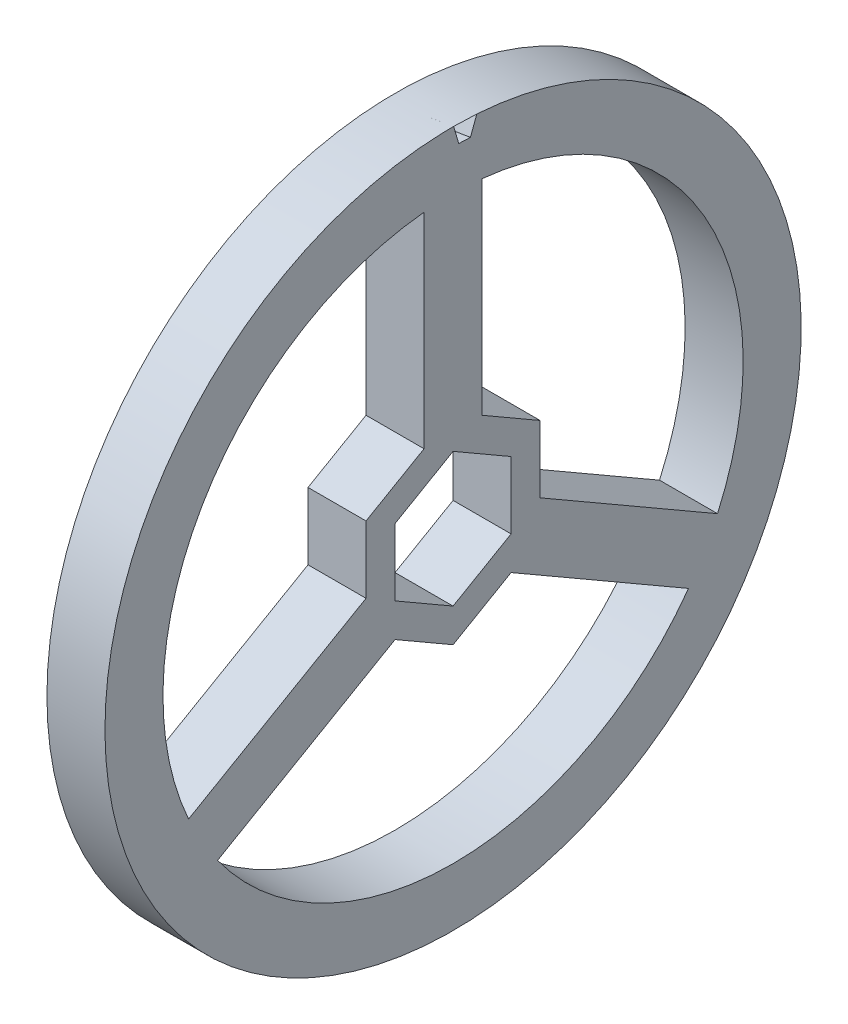
from build123d import *

# Parameters (mm, degrees)
SKETCH1_R           = 30
BOSS_EXTRUDE1_DEPTH = 5


with BuildPart() as part:
    # Sketch1 → Boss-Extrude1 (new body)
    with BuildSketch(Plane(origin=(0, 0, 0), x_dir=(0, 0, -1), z_dir=(1, 0, 0))):
        Circle(SKETCH1_R)
        Polygon((-5, 2.886751346), (0, 5.773502692), (5, 2.886751346), (5, -2.886751346), (0, -5.773502692), (-5, -2.886751346), align=None, mode=Mode.SUBTRACT)
        with BuildLine():
            Line((-7.5, 4.330127019), (-7.5, -1.443375673))
            Line((-7.5, -1.443375673), (-22.792109925, -10.272279454))
            ThreePointArc((-22.792109925, -10.272279454), (-21.650635095, 12.5), (-2.5, 24.874685928))
            Line((-2.5, 24.874685928), (-2.5, 7.216878365))
            Line((-2.5, 7.216878365), (-7.5, 4.330127019))
        make_face(mode=Mode.SUBTRACT)
        with BuildLine():
            Line((0, -8.660254038), (5, -5.773502692))
            Line((5, -5.773502692), (20.292109925, -14.602406473))
            ThreePointArc((20.292109925, -14.602406473), (0, -25), (-20.292109925, -14.602406473))
            Line((-20.292109925, -14.602406473), (-5, -5.773502692))
            Line((-5, -5.773502692), (0, -8.660254038))
        make_face(mode=Mode.SUBTRACT)
        with BuildLine():
            Line((2.5, 7.216878365), (2.5, 24.874685928))
            ThreePointArc((2.5, 24.874685928), (21.650635095, 12.5), (22.792109925, -10.272279454))
            Line((22.792109925, -10.272279454), (7.5, -1.443375673))
            Line((7.5, -1.443375673), (7.5, 4.330127019))
            Line((7.5, 4.330127019), (2.5, 7.216878365))
        make_face(mode=Mode.SUBTRACT)
    extrude(amount=BOSS_EXTRUDE1_DEPTH)

    # Sketch5 for Cut-Loft1 → Cut-Loft1 section 0
    with BuildSketch(Plane(origin=(5, 0, 0), x_dir=(0, 0, -1), z_dir=(1, 0, 0))):
        with BuildLine():
            Line((0.047012254, 29.999963164), (0.494787163, 28.495704688))
            # circular arc as an exact rational Bezier (weights 1, cos(half-angle), 1)
            Bezier((0.494787163, 28.495704688), (0.994788759, 28.487022875), (1.49417799, 28.460805191), weights=[1, 0.999846095, 1])
            Line((1.49417799, 28.460805191), (2.045793908, 29.930164171))
            Bezier((2.045793908, 29.930164171), (1.047567045, 29.998395218), (0.047012254, 29.999963164), weights=[1, 0.99944429, 1])
        make_face()
    # Sketch4 for Cut-Loft1 → Cut-Loft1 section 1
    with BuildSketch(Plane.ZY):
        with BuildLine():
            Line((-1, 29.983328701), (-0.5, 28.495666752))
            Bezier((-0.5, 28.495666752), (0, 28.504440015), (0.5, 28.495666752), weights=[1, 0.999846095, 1])
            Line((0.5, 28.495666752), (1, 29.983328701))
            Bezier((1, 29.983328701), (0, 30.016680568), (-1, 29.983328701), weights=[1, 0.99944429, 1])
        make_face()
    loft(mode=Mode.SUBTRACT)


solid = part.part
